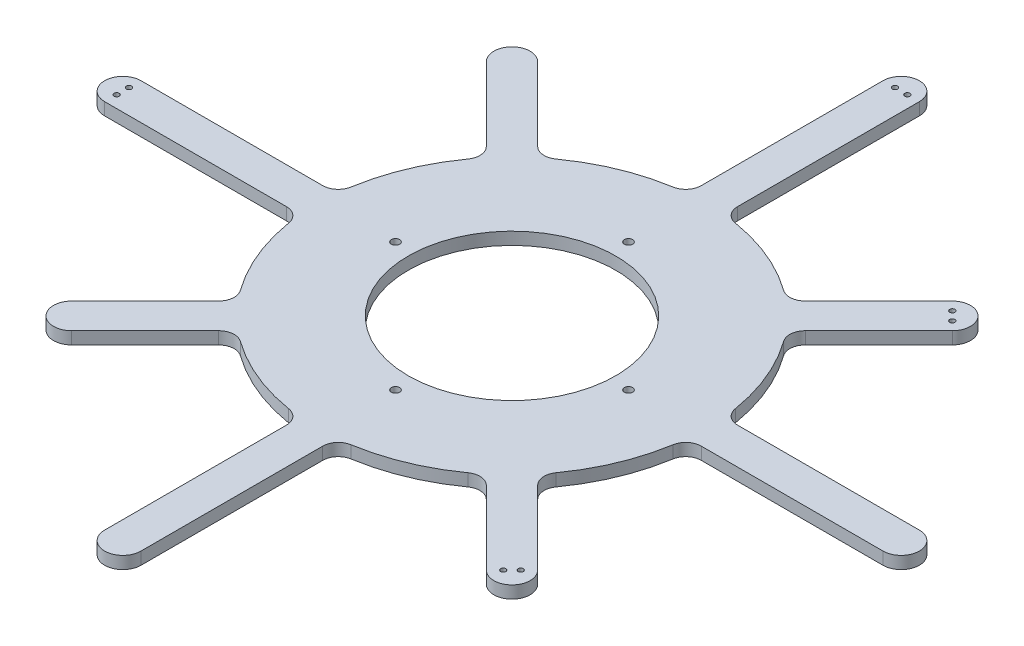
from build123d import *

# Parameters (mm, degrees)
SKETCH1_R                = 37.5
SKETCH1_R_2              = 20
BASE_FLANGE1_DEPTH       = 2.38125
BOSS_EXTRUDE1_DEPTH      = 2.38125
BOSS_EXTRUDE2_DEPTH      = 2.38125
FILLET1_R                = 3
CIRPATTERN1_COUNT        = 4
FILLET1_OF_CIRPATTERN1_R = 3
SKETCH7_R                = 0.5
CUT_EXTRUDE1_DEPTH       = 112.041300207
SKETCH10_R               = 0.79375
CUT_EXTRUDE2_DEPTH       = 112.041300207


# Sheet-metal steps are written as plain solids
with BuildPart() as part:
    # Sketch1 → Base-Flange1 (new body)
    with BuildSketch(Plane(origin=(0, 0, 0), x_dir=(1, 0, 0), z_dir=(0, 1, 0))):
        with Locations(Location((0, 0, 0), (0, 0, 270))):
            Circle(SKETCH1_R)
        with Locations(Location((0, 0, 0), (0, 0, 270))):
            Circle(SKETCH1_R_2, mode=Mode.SUBTRACT)
    extrude(amount=-BASE_FLANGE1_DEPTH)

    # Sketch6 → Boss-Extrude1 (add)
    with BuildSketch(Plane(origin=(0, 0, 0), x_dir=(1, 0, 0), z_dir=(0, 1, 0))):
        with BuildLine():
            Line((-3.5, 75), (-3.5, 37.336309405))
            Line((-3.5, 37.336309405), (3.5, 37.336309405))
            Line((3.5, 37.336309405), (3.5, 75))
            ThreePointArc((3.5, 75), (0, 78.5), (-3.5, 75))
        make_face()
    boss_extrude1 = extrude(amount=-BOSS_EXTRUDE1_DEPTH)

    # Sketch9 → Boss-Extrude2 (add)
    with BuildSketch(Plane(origin=(0, 0, 0), x_dir=(1, 0, 0), z_dir=(0, 1, 0))):
        with BuildLine():
            Line((23.925883831, 28.875631299), (28.875631299, 23.925883831))
            Line((28.875631299, 23.925883831), (44.901280605, 39.951533137))
            ThreePointArc((44.901280605, 39.951533137), (44.901280605, 44.901280605), (39.951533137, 44.901280605))
            Line((39.951533137, 44.901280605), (23.925883831, 28.875631299))
        make_face()
    boss_extrude2 = extrude(amount=-BOSS_EXTRUDE2_DEPTH)

    # Fillet1
    fillet1_edges = [part.edges().sort_by_distance(p)[0] for p in [
        (3.5, -1.190625, -37.336309405),
        (-3.5, -1.190625, -37.336309405),
        (23.925883831, -1.190625, -28.875631299),
        (28.875631299, -1.190625, -23.925883831),
    ]]
    fillet(fillet1_edges, radius=FILLET1_R)

    # CirPattern1: Boss-Extrude1, Boss-Extrude2 ×4 about axis
    cirpattern1_axis = Axis((0, 0, 0), (0, 1, 0))
    add([boss_extrude1.rotate(cirpattern1_axis, i * 360 / CIRPATTERN1_COUNT) for i in range(1, CIRPATTERN1_COUNT)])
    add([boss_extrude2.rotate(cirpattern1_axis, i * 360 / CIRPATTERN1_COUNT) for i in range(1, CIRPATTERN1_COUNT)])

    # Fillet1 of CirPattern1
    fillet1_of_cirpattern1_edges = [part.edges().sort_by_distance(p)[0] for p in [
        (-37.336309405, -1.190625, -3.5),
        (-37.336309405, -1.190625, 3.5),
        (-28.875631299, -1.190625, -23.925883831),
        (-23.925883831, -1.190625, -28.875631299),
        (-3.5, -1.190625, 37.336309405),
        (3.5, -1.190625, 37.336309405),
        (-23.925883831, -1.190625, 28.875631299),
        (-28.875631299, -1.190625, 23.925883831),
        (37.336309405, -1.190625, 3.5),
        (37.336309405, -1.190625, -3.5),
        (28.875631299, -1.190625, 23.925883831),
        (23.925883831, -1.190625, 28.875631299),
    ]]
    fillet(fillet1_of_cirpattern1_edges, radius=FILLET1_OF_CIRPATTERN1_R)

    # Sketch7 → Cut-Extrude1 (cut, through all)
    with BuildSketch(Plane(origin=(0, 0, 0), x_dir=(1, 0, 0), z_dir=(0, 1, 0))):
        with Locations(Location((-1.190625, 75, 0), (0, 0, 270))):
            Circle(SKETCH7_R)
        with Locations(Location((1.190625, 75, 0), (0, 0, 270))):
            Circle(SKETCH7_R)
        with Locations(Location((41.58450786, 43.268305883, 0), (0, 0, 270))):
            Circle(SKETCH7_R)
        with Locations(Location((43.268305883, 41.58450786, 0), (0, 0, 270))):
            Circle(SKETCH7_R)
        with Locations(Location((-75, -1.190625, 0), (0, 0, 270))):
            Circle(SKETCH7_R)
        with Locations(Location((-75, 1.190625, 0), (0, 0, 270))):
            Circle(SKETCH7_R)
        with Locations(Location((43.268305883, -41.58450786, 0), (0, 0, 270))):
            Circle(SKETCH7_R)
        with Locations(Location((41.58450786, -43.268305883, 0), (0, 0, 270))):
            Circle(SKETCH7_R)
    extrude(amount=-CUT_EXTRUDE1_DEPTH, mode=Mode.SUBTRACT)

    # Sketch10 → Cut-Extrude2 (cut, through all)
    with BuildSketch(Plane(origin=(0, 0, 0), x_dir=(1, 0, 0), z_dir=(0, 1, 0))):
        with Locations(Location((-23.573172318, 1.122532015, 0), (0, 0, 270))):
            Circle(SKETCH10_R)
        with Locations(Location((-1.122532015, 23.573172318, 0), (0, 0, 270))):
            Circle(SKETCH10_R)
        with Locations(Location((23.573172318, -1.122532015, 0), (0, 0, 270))):
            Circle(SKETCH10_R)
        with Locations(Location((1.122532015, -23.573172318, 0), (0, 0, 270))):
            Circle(SKETCH10_R)
    extrude(amount=-CUT_EXTRUDE2_DEPTH, mode=Mode.SUBTRACT)


solid = part.part
